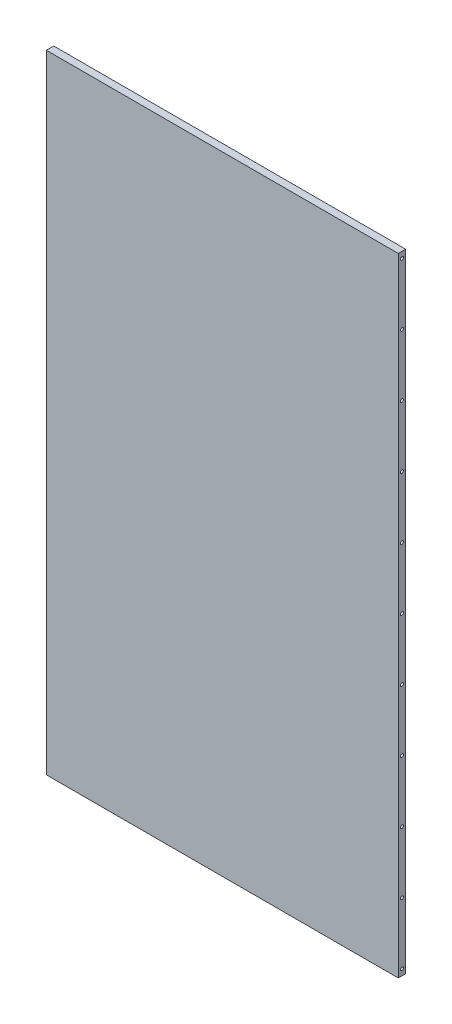
from build123d import *

# Parameters (mm, degrees)
SKETCH1_W            = 286
SKETCH1_H            = 510
BOSS_EXTRUDE1_DEPTH  = 5.9944
LPATTERN1_COUNT      = 6
LPATTERN1_PITCH      = 50
LPATTERN1_COUNT_DIR2 = 6
LPATTERN1_PITCH_DIR2 = 50


with BuildPart() as part:
    # Sketch1 → Boss-Extrude1 (new body)
    with BuildSketch(Plane.XY):
        with Locations((143, 255)):
            Rectangle(SKETCH1_W, SKETCH1_H)
    extrude(amount=BOSS_EXTRUDE1_DEPTH)

    # Sketch2 → Tap Drill for M3x0.5 Tap1 (revolve, cut)
    with BuildSketch(Plane(origin=(286, 255, 2.9972), x_dir=(0, 0, -1), z_dir=(0, 1, 0))):
        Polygon((0, 0), (0, 30.751075774), (1.25, 30), (1.25, 0), align=None)
    tap_drill_for_m3x0_5_tap1 = revolve(axis=Axis((292.35, 255, 2.9972), (-1, 0, 0)), mode=Mode.SUBTRACT)

    # LPattern1: Tap Drill for M3x0.5 Tap1 6 × 6
    with Locations(*[Vector(0, 1, 0) * (i * LPATTERN1_PITCH) + Vector(0, -1, 0) * (j * LPATTERN1_PITCH_DIR2) for i in range(LPATTERN1_COUNT) for j in range(LPATTERN1_COUNT_DIR2) if (i, j) != (0, 0)]):
        add(tap_drill_for_m3x0_5_tap1, mode=Mode.SUBTRACT)

    # Mirror1: Tap Drill for M3x0.5 Tap1 across plane
    add(tap_drill_for_m3x0_5_tap1.mirror(Plane(origin=(143, 0, 0), x_dir=(0, 0, 1), z_dir=(1, 0, 0))), mode=Mode.SUBTRACT)

    # Mirror1 copy 1 sketch → Mirror1 copy 1 (revolve, cut)
    with BuildSketch(Plane(origin=(0, 205, 2.9972), x_dir=(0, 0, -1), z_dir=(0, 1, 0))):
        Polygon((0, 0), (0, -30.751075774), (1.25, -30), (1.25, 0), align=None)
    revolve(axis=Axis((-6.35, 205, 2.9972), (-1, 0, 0)), mode=Mode.SUBTRACT)

    # Mirror1 copy 2 sketch → Mirror1 copy 2 (revolve, cut)
    with BuildSketch(Plane(origin=(0, 155, 2.9972), x_dir=(0, 0, -1), z_dir=(0, 1, 0))):
        Polygon((0, 0), (0, -30.751075774), (1.25, -30), (1.25, 0), align=None)
    revolve(axis=Axis((-6.35, 155, 2.9972), (-1, 0, 0)), mode=Mode.SUBTRACT)

    # Mirror1 copy 3 sketch → Mirror1 copy 3 (revolve, cut)
    with BuildSketch(Plane(origin=(0, 105, 2.9972), x_dir=(0, 0, -1), z_dir=(0, 1, 0))):
        Polygon((0, 0), (0, -30.751075774), (1.25, -30), (1.25, 0), align=None)
    revolve(axis=Axis((-6.35, 105, 2.9972), (-1, 0, 0)), mode=Mode.SUBTRACT)

    # Mirror1 copy 4 sketch → Mirror1 copy 4 (revolve, cut)
    with BuildSketch(Plane(origin=(0, 55, 2.9972), x_dir=(0, 0, -1), z_dir=(0, 1, 0))):
        Polygon((0, 0), (0, -30.751075774), (1.25, -30), (1.25, 0), align=None)
    revolve(axis=Axis((-6.35, 55, 2.9972), (-1, 0, 0)), mode=Mode.SUBTRACT)

    # Mirror1 copy 5 sketch → Mirror1 copy 5 (revolve, cut)
    with BuildSketch(Plane(origin=(0, 5, 2.9972), x_dir=(0, 0, -1), z_dir=(0, 1, 0))):
        Polygon((0, 0), (0, -30.751075774), (1.25, -30), (1.25, 0), align=None)
    revolve(axis=Axis((-6.35, 5, 2.9972), (-1, 0, 0)), mode=Mode.SUBTRACT)

    # Mirror1 copy 6 sketch → Mirror1 copy 6 (revolve, cut)
    with BuildSketch(Plane(origin=(0, 305, 2.9972), x_dir=(0, 0, -1), z_dir=(0, 1, 0))):
        Polygon((0, 0), (0, -30.751075774), (1.25, -30), (1.25, 0), align=None)
    revolve(axis=Axis((-6.35, 305, 2.9972), (-1, 0, 0)), mode=Mode.SUBTRACT)

    # Mirror1 copy 7 sketch → Mirror1 copy 7 (revolve, cut)
    with BuildSketch(Plane(origin=(0, 255, 2.9972), x_dir=(0, 0, -1), z_dir=(0, 1, 0))):
        Polygon((0, 0), (0, -30.751075774), (1.25, -30), (1.25, 0), align=None)
    revolve(axis=Axis((-6.35, 255, 2.9972), (-1, 0, 0)), mode=Mode.SUBTRACT)

    # Mirror1 copy 8 sketch → Mirror1 copy 8 (revolve, cut)
    with BuildSketch(Plane(origin=(0, 205, 2.9972), x_dir=(0, 0, -1), z_dir=(0, 1, 0))):
        Polygon((0, 0), (0, -30.751075774), (1.25, -30), (1.25, 0), align=None)
    revolve(axis=Axis((-6.35, 205, 2.9972), (-1, 0, 0)), mode=Mode.SUBTRACT)

    # Mirror1 copy 9 sketch → Mirror1 copy 9 (revolve, cut)
    with BuildSketch(Plane(origin=(0, 155, 2.9972), x_dir=(0, 0, -1), z_dir=(0, 1, 0))):
        Polygon((0, 0), (0, -30.751075774), (1.25, -30), (1.25, 0), align=None)
    revolve(axis=Axis((-6.35, 155, 2.9972), (-1, 0, 0)), mode=Mode.SUBTRACT)

    # Mirror1 copy 10 sketch → Mirror1 copy 10 (revolve, cut)
    with BuildSketch(Plane(origin=(0, 105, 2.9972), x_dir=(0, 0, -1), z_dir=(0, 1, 0))):
        Polygon((0, 0), (0, -30.751075774), (1.25, -30), (1.25, 0), align=None)
    revolve(axis=Axis((-6.35, 105, 2.9972), (-1, 0, 0)), mode=Mode.SUBTRACT)

    # Mirror1 copy 11 sketch → Mirror1 copy 11 (revolve, cut)
    with BuildSketch(Plane(origin=(0, 55, 2.9972), x_dir=(0, 0, -1), z_dir=(0, 1, 0))):
        Polygon((0, 0), (0, -30.751075774), (1.25, -30), (1.25, 0), align=None)
    revolve(axis=Axis((-6.35, 55, 2.9972), (-1, 0, 0)), mode=Mode.SUBTRACT)

    # Mirror1 copy 12 sketch → Mirror1 copy 12 (revolve, cut)
    with BuildSketch(Plane(origin=(0, 355, 2.9972), x_dir=(0, 0, -1), z_dir=(0, 1, 0))):
        Polygon((0, 0), (0, -30.751075774), (1.25, -30), (1.25, 0), align=None)
    revolve(axis=Axis((-6.35, 355, 2.9972), (-1, 0, 0)), mode=Mode.SUBTRACT)

    # Mirror1 copy 13 sketch → Mirror1 copy 13 (revolve, cut)
    with BuildSketch(Plane(origin=(0, 305, 2.9972), x_dir=(0, 0, -1), z_dir=(0, 1, 0))):
        Polygon((0, 0), (0, -30.751075774), (1.25, -30), (1.25, 0), align=None)
    revolve(axis=Axis((-6.35, 305, 2.9972), (-1, 0, 0)), mode=Mode.SUBTRACT)

    # Mirror1 copy 14 sketch → Mirror1 copy 14 (revolve, cut)
    with BuildSketch(Plane(origin=(0, 255, 2.9972), x_dir=(0, 0, -1), z_dir=(0, 1, 0))):
        Polygon((0, 0), (0, -30.751075774), (1.25, -30), (1.25, 0), align=None)
    revolve(axis=Axis((-6.35, 255, 2.9972), (-1, 0, 0)), mode=Mode.SUBTRACT)

    # Mirror1 copy 15 sketch → Mirror1 copy 15 (revolve, cut)
    with BuildSketch(Plane(origin=(0, 205, 2.9972), x_dir=(0, 0, -1), z_dir=(0, 1, 0))):
        Polygon((0, 0), (0, -30.751075774), (1.25, -30), (1.25, 0), align=None)
    revolve(axis=Axis((-6.35, 205, 2.9972), (-1, 0, 0)), mode=Mode.SUBTRACT)

    # Mirror1 copy 16 sketch → Mirror1 copy 16 (revolve, cut)
    with BuildSketch(Plane(origin=(0, 155, 2.9972), x_dir=(0, 0, -1), z_dir=(0, 1, 0))):
        Polygon((0, 0), (0, -30.751075774), (1.25, -30), (1.25, 0), align=None)
    revolve(axis=Axis((-6.35, 155, 2.9972), (-1, 0, 0)), mode=Mode.SUBTRACT)

    # Mirror1 copy 17 sketch → Mirror1 copy 17 (revolve, cut)
    with BuildSketch(Plane(origin=(0, 105, 2.9972), x_dir=(0, 0, -1), z_dir=(0, 1, 0))):
        Polygon((0, 0), (0, -30.751075774), (1.25, -30), (1.25, 0), align=None)
    revolve(axis=Axis((-6.35, 105, 2.9972), (-1, 0, 0)), mode=Mode.SUBTRACT)

    # Mirror1 copy 18 sketch → Mirror1 copy 18 (revolve, cut)
    with BuildSketch(Plane(origin=(0, 405, 2.9972), x_dir=(0, 0, -1), z_dir=(0, 1, 0))):
        Polygon((0, 0), (0, -30.751075774), (1.25, -30), (1.25, 0), align=None)
    revolve(axis=Axis((-6.35, 405, 2.9972), (-1, 0, 0)), mode=Mode.SUBTRACT)

    # Mirror1 copy 19 sketch → Mirror1 copy 19 (revolve, cut)
    with BuildSketch(Plane(origin=(0, 355, 2.9972), x_dir=(0, 0, -1), z_dir=(0, 1, 0))):
        Polygon((0, 0), (0, -30.751075774), (1.25, -30), (1.25, 0), align=None)
    revolve(axis=Axis((-6.35, 355, 2.9972), (-1, 0, 0)), mode=Mode.SUBTRACT)

    # Mirror1 copy 20 sketch → Mirror1 copy 20 (revolve, cut)
    with BuildSketch(Plane(origin=(0, 305, 2.9972), x_dir=(0, 0, -1), z_dir=(0, 1, 0))):
        Polygon((0, 0), (0, -30.751075774), (1.25, -30), (1.25, 0), align=None)
    revolve(axis=Axis((-6.35, 305, 2.9972), (-1, 0, 0)), mode=Mode.SUBTRACT)

    # Mirror1 copy 21 sketch → Mirror1 copy 21 (revolve, cut)
    with BuildSketch(Plane(origin=(0, 255, 2.9972), x_dir=(0, 0, -1), z_dir=(0, 1, 0))):
        Polygon((0, 0), (0, -30.751075774), (1.25, -30), (1.25, 0), align=None)
    revolve(axis=Axis((-6.35, 255, 2.9972), (-1, 0, 0)), mode=Mode.SUBTRACT)

    # Mirror1 copy 22 sketch → Mirror1 copy 22 (revolve, cut)
    with BuildSketch(Plane(origin=(0, 205, 2.9972), x_dir=(0, 0, -1), z_dir=(0, 1, 0))):
        Polygon((0, 0), (0, -30.751075774), (1.25, -30), (1.25, 0), align=None)
    revolve(axis=Axis((-6.35, 205, 2.9972), (-1, 0, 0)), mode=Mode.SUBTRACT)

    # Mirror1 copy 23 sketch → Mirror1 copy 23 (revolve, cut)
    with BuildSketch(Plane(origin=(0, 155, 2.9972), x_dir=(0, 0, -1), z_dir=(0, 1, 0))):
        Polygon((0, 0), (0, -30.751075774), (1.25, -30), (1.25, 0), align=None)
    revolve(axis=Axis((-6.35, 155, 2.9972), (-1, 0, 0)), mode=Mode.SUBTRACT)

    # Mirror1 copy 24 sketch → Mirror1 copy 24 (revolve, cut)
    with BuildSketch(Plane(origin=(0, 455, 2.9972), x_dir=(0, 0, -1), z_dir=(0, 1, 0))):
        Polygon((0, 0), (0, -30.751075774), (1.25, -30), (1.25, 0), align=None)
    revolve(axis=Axis((-6.35, 455, 2.9972), (-1, 0, 0)), mode=Mode.SUBTRACT)

    # Mirror1 copy 25 sketch → Mirror1 copy 25 (revolve, cut)
    with BuildSketch(Plane(origin=(0, 405, 2.9972), x_dir=(0, 0, -1), z_dir=(0, 1, 0))):
        Polygon((0, 0), (0, -30.751075774), (1.25, -30), (1.25, 0), align=None)
    revolve(axis=Axis((-6.35, 405, 2.9972), (-1, 0, 0)), mode=Mode.SUBTRACT)

    # Mirror1 copy 26 sketch → Mirror1 copy 26 (revolve, cut)
    with BuildSketch(Plane(origin=(0, 355, 2.9972), x_dir=(0, 0, -1), z_dir=(0, 1, 0))):
        Polygon((0, 0), (0, -30.751075774), (1.25, -30), (1.25, 0), align=None)
    revolve(axis=Axis((-6.35, 355, 2.9972), (-1, 0, 0)), mode=Mode.SUBTRACT)

    # Mirror1 copy 27 sketch → Mirror1 copy 27 (revolve, cut)
    with BuildSketch(Plane(origin=(0, 305, 2.9972), x_dir=(0, 0, -1), z_dir=(0, 1, 0))):
        Polygon((0, 0), (0, -30.751075774), (1.25, -30), (1.25, 0), align=None)
    revolve(axis=Axis((-6.35, 305, 2.9972), (-1, 0, 0)), mode=Mode.SUBTRACT)

    # Mirror1 copy 28 sketch → Mirror1 copy 28 (revolve, cut)
    with BuildSketch(Plane(origin=(0, 255, 2.9972), x_dir=(0, 0, -1), z_dir=(0, 1, 0))):
        Polygon((0, 0), (0, -30.751075774), (1.25, -30), (1.25, 0), align=None)
    revolve(axis=Axis((-6.35, 255, 2.9972), (-1, 0, 0)), mode=Mode.SUBTRACT)

    # Mirror1 copy 29 sketch → Mirror1 copy 29 (revolve, cut)
    with BuildSketch(Plane(origin=(0, 205, 2.9972), x_dir=(0, 0, -1), z_dir=(0, 1, 0))):
        Polygon((0, 0), (0, -30.751075774), (1.25, -30), (1.25, 0), align=None)
    revolve(axis=Axis((-6.35, 205, 2.9972), (-1, 0, 0)), mode=Mode.SUBTRACT)

    # Mirror1 copy 30 sketch → Mirror1 copy 30 (revolve, cut)
    with BuildSketch(Plane(origin=(0, 505, 2.9972), x_dir=(0, 0, -1), z_dir=(0, 1, 0))):
        Polygon((0, 0), (0, -30.751075774), (1.25, -30), (1.25, 0), align=None)
    revolve(axis=Axis((-6.35, 505, 2.9972), (-1, 0, 0)), mode=Mode.SUBTRACT)

    # Mirror1 copy 31 sketch → Mirror1 copy 31 (revolve, cut)
    with BuildSketch(Plane(origin=(0, 455, 2.9972), x_dir=(0, 0, -1), z_dir=(0, 1, 0))):
        Polygon((0, 0), (0, -30.751075774), (1.25, -30), (1.25, 0), align=None)
    revolve(axis=Axis((-6.35, 455, 2.9972), (-1, 0, 0)), mode=Mode.SUBTRACT)

    # Mirror1 copy 32 sketch → Mirror1 copy 32 (revolve, cut)
    with BuildSketch(Plane(origin=(0, 405, 2.9972), x_dir=(0, 0, -1), z_dir=(0, 1, 0))):
        Polygon((0, 0), (0, -30.751075774), (1.25, -30), (1.25, 0), align=None)
    revolve(axis=Axis((-6.35, 405, 2.9972), (-1, 0, 0)), mode=Mode.SUBTRACT)

    # Mirror1 copy 33 sketch → Mirror1 copy 33 (revolve, cut)
    with BuildSketch(Plane(origin=(0, 355, 2.9972), x_dir=(0, 0, -1), z_dir=(0, 1, 0))):
        Polygon((0, 0), (0, -30.751075774), (1.25, -30), (1.25, 0), align=None)
    revolve(axis=Axis((-6.35, 355, 2.9972), (-1, 0, 0)), mode=Mode.SUBTRACT)

    # Mirror1 copy 34 sketch → Mirror1 copy 34 (revolve, cut)
    with BuildSketch(Plane(origin=(0, 305, 2.9972), x_dir=(0, 0, -1), z_dir=(0, 1, 0))):
        Polygon((0, 0), (0, -30.751075774), (1.25, -30), (1.25, 0), align=None)
    revolve(axis=Axis((-6.35, 305, 2.9972), (-1, 0, 0)), mode=Mode.SUBTRACT)

    # Mirror1 copy 35 sketch → Mirror1 copy 35 (revolve, cut)
    with BuildSketch(Plane(origin=(0, 255, 2.9972), x_dir=(0, 0, -1), z_dir=(0, 1, 0))):
        Polygon((0, 0), (0, -30.751075774), (1.25, -30), (1.25, 0), align=None)
    revolve(axis=Axis((-6.35, 255, 2.9972), (-1, 0, 0)), mode=Mode.SUBTRACT)


solid = part.part
